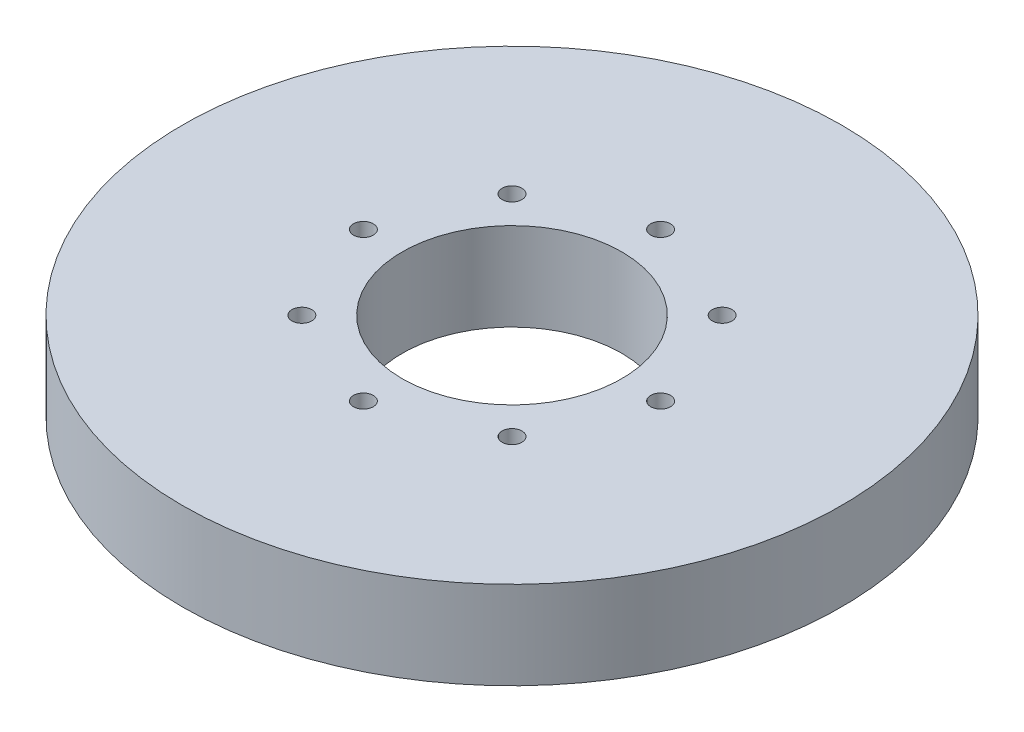
from build123d import *

# Parameters (mm, degrees)
SKETCH1_R           = 82.5
BOSS_EXTRUDE1_DEPTH = 22
SKETCH2_R           = 27.5
CUT_EXTRUDE1_DEPTH  = 119.728682297
SKETCH3_R           = 2.473860502
CUT_EXTRUDE2_DEPTH  = 18.704156355
CIRPATTERN1_COUNT   = 8


with BuildPart() as part:
    # Sketch1 → Boss-Extrude1 (new body)
    with BuildSketch(Plane(origin=(0, 0, 0), x_dir=(1, 0, 0), z_dir=(0, 1, 0))):
        Circle(SKETCH1_R)
    extrude(amount=BOSS_EXTRUDE1_DEPTH)

    # Sketch2 → Cut-Extrude1 (cut, through all)
    with BuildSketch(Plane(origin=(0, 0, 0), x_dir=(1, 0, 0), z_dir=(0, 1, 0))):
        Circle(SKETCH2_R)
    extrude(amount=CUT_EXTRUDE1_DEPTH, mode=Mode.SUBTRACT)

    # Sketch3 → Cut-Extrude2 (cut)
    with BuildSketch(Plane(origin=(0, 22, 0), x_dir=(1, 0, 0), z_dir=(0, 1, 0))):
        with Locations((-37.202802875, 0)):
            Circle(SKETCH3_R)
    cut_extrude2 = extrude(amount=-CUT_EXTRUDE2_DEPTH, mode=Mode.SUBTRACT)

    # CirPattern1: Cut-Extrude2 ×8 about axis
    cirpattern1_axis = Axis((0, 0, 0), (0, 1, 0))
    for i in range(1, CIRPATTERN1_COUNT):
        add(cut_extrude2.rotate(cirpattern1_axis, i * 360 / CIRPATTERN1_COUNT), mode=Mode.SUBTRACT)


solid = part.part
